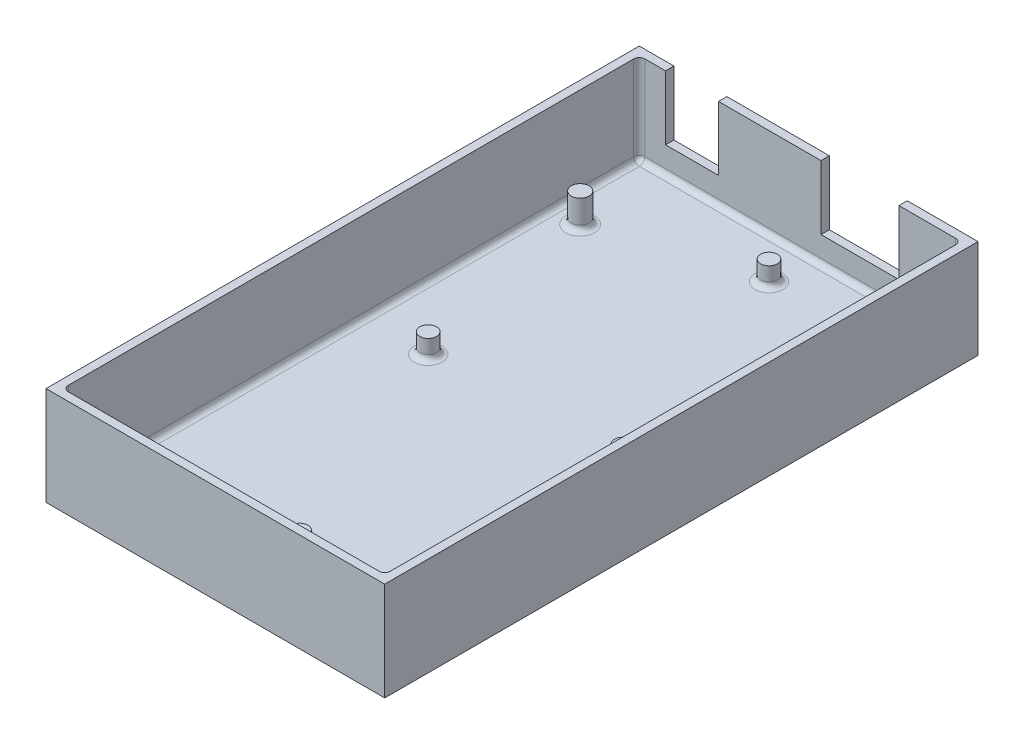
from build123d import *

# Parameters (mm, degrees)
BOSS_EXTRUDE1_START = -3.5
SKETCH1_W           = 60.8
SKETCH1_H           = 106.5
BOSS_EXTRUDE1_DEPTH = 1.5
BOSS_EXTRUDE2_START = -3.5
BOSS_EXTRUDE2_DEPTH = 3.5
BOSS_EXTRUDE3_DEPTH = 1.7
SKETCH2_R           = 1.5
BOSS_EXTRUDE4_DEPTH = 3.5
BOSS_EXTRUDE5_START = -3.5
SKETCH1_7_R         = 1.6
BOSS_EXTRUDE5_DEPTH = 5.2
FILLET5_R           = 1
SKETCH3_W           = 18.393615341
SKETCH3_H           = 1.5
BOSS_EXTRUDE6_DEPTH = 11
SKETCH4_W           = 13.991439111
SKETCH4_H           = 0.5
SKETCH4_W_2         = 9.5
CUT_EXTRUDE1_DEPTH  = 11
FILLET6_R           = 1


with BuildPart() as part:
    # Sketch1 → Boss-Extrude1 (new body)
    with BuildSketch(Plane(origin=(0, 0, 0), x_dir=(1, 0, 0), z_dir=(0, 1, 0)).offset(BOSS_EXTRUDE1_START)):
        with Locations((-1.65, -36.42)):
            Rectangle(SKETCH1_W, SKETCH1_H)
    extrude(amount=-BOSS_EXTRUDE1_DEPTH)



with BuildPart() as body_2:
    # Sketch1<3> → Boss-Extrude2 (new body)
    with BuildSketch(Plane(origin=(0, 0, 0), x_dir=(1, 0, 0), z_dir=(0, 1, 0)).offset(BOSS_EXTRUDE2_START)):
        Polygon((-32.05, 16.83), (28.75, 16.83), (28.75, -89.67), (-2.2, -89.67), (-32.05, -89.67), align=None)
        Polygon((-30.55, -88.17), (-30.55, 15.33), (27.25, 15.33), (27.25, -88.17), (-2.2, -88.17), align=None, mode=Mode.SUBTRACT)
    extrude(amount=BOSS_EXTRUDE2_DEPTH)

    # Sketch1<5> → Boss-Extrude3 (add)
    with BuildSketch(Plane(origin=(0, 0, 0), x_dir=(1, 0, 0), z_dir=(0, 1, 0))):
        Polygon((-32.05, 16.83), (28.75, 16.83), (28.75, -89.67), (-2.2, -89.67), (-32.05, -89.67), align=None)
        Polygon((-30.55, -88.17), (-30.55, 15.33), (27.25, 15.33), (27.25, -88.17), (-2.2, -88.17), align=None, mode=Mode.SUBTRACT)
    extrude(amount=BOSS_EXTRUDE3_DEPTH)


with BuildPart() as part_1:
    add(part.part)

    add(body_2.part)  # Boss-Extrude4 merges body 2
    # Sketch2 → Boss-Extrude4 (add)
    with BuildSketch(Plane(origin=(0, -3.5, 0), x_dir=(1, 0, 0), z_dir=(0, 1, 0))):
        with Locations(Location((0, -76.2, 0), (0, 0, 270))):
            Circle(SKETCH2_R)
        with Locations(Location((-19.296980253, -33.814802094, 0), (0, 0, 270))):
            Circle(SKETCH2_R)
        with Locations(Location((15.644023456, -33.814802094, 0), (0, 0, 270))):
            Circle(SKETCH2_R)
        with Locations(Location((0, 8.063923473, 0), (0, 0, 270))):
            Circle(SKETCH2_R)
    extrude(amount=BOSS_EXTRUDE4_DEPTH)

    # Sketch1<7> → Boss-Extrude5 (add)
    with BuildSketch(Plane(origin=(0, 0, 0), x_dir=(1, 0, 0), z_dir=(0, 1, 0)).offset(BOSS_EXTRUDE5_START)):
        with Locations(Location((-25.83, 0, 0), (0, 0, 270))):
            Circle(SKETCH1_7_R)
        with Locations(Location((22.43, -1.27, 0), (0, 0, 270))):
            Circle(SKETCH1_7_R)
        with Locations(Location((-25.83, -82.55, 0), (0, 0, 270))):
            Circle(SKETCH1_7_R)
        with Locations(Location((22.43, -76.2, 0), (0, 0, 270))):
            Circle(SKETCH1_7_R)
    extrude(amount=BOSS_EXTRUDE5_DEPTH)

    # Fillet5
    fillet5_edges = [part_1.edges().sort_by_distance(p)[0] for p in [
        (0, -3.5, 74.7),
        (-30.55, -3.5, 36.42),
        (-1.65, -3.5, -15.33),
        (-1.65, -3.5, 88.17),
        (27.25, -3.5, 36.42),
        (-19.296980253, -3.5, 32.314802094),
        (15.644023456, -3.5, 32.314802094),
        (0, -3.5, -9.563923473),
        (-25.83, -3.5, -1.6),
        (22.43, -3.5, -0.33),
        (-25.83, -3.5, 80.95),
        (22.43, -3.5, 74.6),
    ]]
    fillet(fillet5_edges, radius=FILLET5_R)

    # Sketch3 → Boss-Extrude6 (add)
    with BuildSketch(Plane(origin=(0, 1.7, 0), x_dir=(1, 0, 0), z_dir=(0, 1, 0))):
        Polygon((-25.83, 16.83), (-32.05, 16.83), (-32.05, -89.67), (28.75, -89.67), (28.75, 16.83), (16.055054452, 16.83), (16.055054452, 15.33), (27.25, 15.33), (27.25, -88.17), (-30.55, -88.17), (-30.55, 15.33), (-25.83, 15.33), align=None)
        with Locations((-7.13319233, 16.08)):
            Rectangle(SKETCH3_W, SKETCH3_H)
    extrude(amount=BOSS_EXTRUDE6_DEPTH)

    # Sketch4 → Cut-Extrude1 (cut)
    with BuildSketch(Plane(origin=(0, 0, -16.83), x_dir=(-1, 0, 0), z_dir=(0, 0, -1))):
        with Locations((-9.059334897, 1.45)):
            Rectangle(SKETCH4_W, SKETCH4_H)
        with Locations((21.08, 1.45)):
            Rectangle(SKETCH4_W_2, SKETCH4_H)
    extrude(amount=-CUT_EXTRUDE1_DEPTH, mode=Mode.SUBTRACT)

    # Fillet6
    # the kernel refuses this fillet: 1 mm, written as the material it adds along each edge
    with BuildSketch(Plane(origin=(-29.55, -2.5, 87.17), x_dir=(-1, 0, 0), z_dir=(0, 0, 1))) as fillet6_piece_1_section:
        Polygon((0, 0), (FILLET6_R, 0), (FILLET6_R, FILLET6_R), (0, FILLET6_R), align=None)
    fillet6_piece_1 = extrude(amount=FILLET6_R, mode=Mode.PRIVATE)
    fillet6_piece_1 = fillet6_piece_1 - Plane(origin=(-29.55, -2.5, 87.17), x_dir=(0.7071067811865475, 0.7071067811865475, 0), z_dir=(0, 0, 1)) * Sphere(FILLET6_R, mode=Mode.PRIVATE)
    add(fillet6_piece_1)
    with BuildSketch(Plane(origin=(-29.55, -2.5, -14.33), x_dir=(-1, 0, 0), z_dir=(0, 0, -1))) as fillet6_piece_2_section:
        Polygon((0, 0), (FILLET6_R, 0), (FILLET6_R, -FILLET6_R), (0, -FILLET6_R), align=None)
    fillet6_piece_2 = extrude(amount=FILLET6_R, mode=Mode.PRIVATE)
    fillet6_piece_2 = fillet6_piece_2 - Plane(origin=(-29.55, -2.5, -14.33), x_dir=(0.7071067811865475, 0.7071067811865475, 0), z_dir=(0, 0, -1)) * Sphere(FILLET6_R, mode=Mode.PRIVATE)
    add(fillet6_piece_2)
    with BuildSketch(Plane(origin=(26.25, -2.5, 87.17), x_dir=(1, 0, 0), z_dir=(0, 0, 1))) as fillet6_piece_3_section:
        Polygon((0, 0), (FILLET6_R, 0), (FILLET6_R, -FILLET6_R), (0, -FILLET6_R), align=None)
    fillet6_piece_3 = extrude(amount=FILLET6_R, mode=Mode.PRIVATE)
    fillet6_piece_3 = fillet6_piece_3 - Plane(origin=(26.25, -2.5, 87.17), x_dir=(-0.7071067811865475, 0.7071067811865475, 0), z_dir=(0, 0, 1)) * Sphere(FILLET6_R, mode=Mode.PRIVATE)
    add(fillet6_piece_3)
    with BuildSketch(Plane(origin=(26.25, -2.5, -14.33), x_dir=(1, 0, 0), z_dir=(0, 0, -1))) as fillet6_piece_4_section:
        Polygon((0, 0), (FILLET6_R, 0), (FILLET6_R, FILLET6_R), (0, FILLET6_R), align=None)
    fillet6_piece_4 = extrude(amount=FILLET6_R, mode=Mode.PRIVATE)
    fillet6_piece_4 = fillet6_piece_4 - Plane(origin=(26.25, -2.5, -14.33), x_dir=(-0.7071067811865475, 0.7071067811865475, 0), z_dir=(0, 0, -1)) * Sphere(FILLET6_R, mode=Mode.PRIVATE)
    add(fillet6_piece_4)
    with BuildSketch(Plane(origin=(-30.55, -2.5, 88.17), x_dir=(1, 0, 0), z_dir=(0, 1, 0)), Plane(origin=(27.25, 12.7, 88.17), x_dir=(-1, 0, 0), z_dir=(0, -1, 0))) as fillet6_piece_5:
        with BuildLine():
            CenterArc((FILLET6_R, FILLET6_R), FILLET6_R, 180, 90)
            Line((0, FILLET6_R), (0, 0))
            Line((0, 0), (FILLET6_R, 0))
        make_face()
    extrude(amount=15.2)
    with BuildSketch(Plane(origin=(-30.55, -2.5, -15.33), x_dir=(1, 0, 0), z_dir=(0, 1, 0)), Plane(origin=(27.25, 12.7, -15.33), x_dir=(-1, 0, 0), z_dir=(0, -1, 0))) as fillet6_piece_6:
        with BuildLine():
            CenterArc((FILLET6_R, -FILLET6_R), FILLET6_R, 90, 90)
            Line((0, -FILLET6_R), (0, 0))
            Line((0, 0), (FILLET6_R, 0))
        make_face()
    extrude(amount=15.2)


solid = part_1.part
